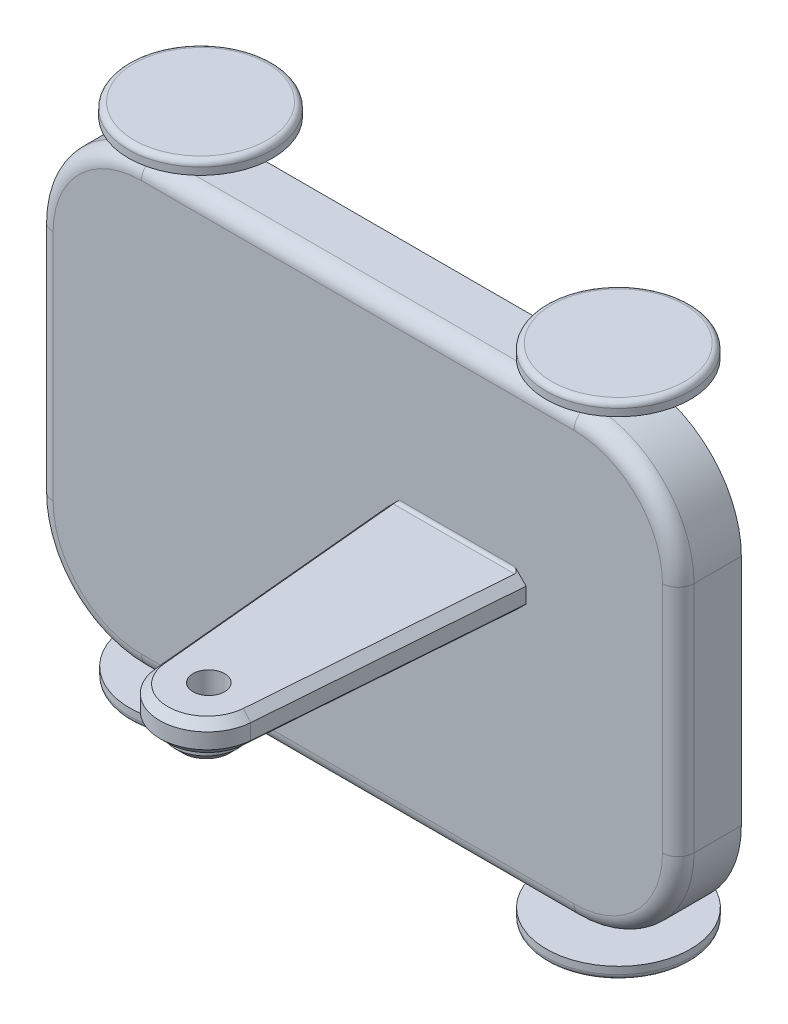
from build123d import *

# Parameters (mm, degrees)
BOSS_EXTRUDE1_DEPTH  = 20
FILLET1_R            = 5
BOSS_EXTRUDE10_DEPTH = 5
CHAMFER1_SIZE        = 2.54
CHAMFER2_SIZE        = 2.54
SKETCH13_R           = 10
BOSS_EXTRUDE11_DEPTH = 5
SKETCH14_R           = 5
CUT_EXTRUDE1_DEPTH   = 10
CHAMFER3_SIZE        = 2.54
FILLET5_R            = 1.016
BOSS_EXTRUDE13_DEPTH = 0.508
FILLET6_R            = 1.27
SKETCH16_W           = 4.572
SKETCH16_H           = 4.572
BOSS_EXTRUDE14_DEPTH = 5.588
SKETCH17_W           = 4.572
SKETCH17_H           = 4.572
BOSS_EXTRUDE15_DEPTH = 5.588
SKETCH18_W           = 4.572
SKETCH18_H           = 4.572
BOSS_EXTRUDE16_DEPTH = 5.588
SKETCH19_W           = 4.572
SKETCH19_H           = 4.572
BOSS_EXTRUDE17_DEPTH = 5.588
SKETCH20_R           = 22.86
BOSS_EXTRUDE18_DEPTH = 4.064
SKETCH21_R           = 22.86
BOSS_EXTRUDE19_DEPTH = 4.064
SKETCH22_R           = 22.86
BOSS_EXTRUDE20_DEPTH = 4.064
SKETCH23_R           = 22.86
BOSS_EXTRUDE21_DEPTH = 4.064
FILLET7_R            = 1.778


with BuildPart() as part:
    # Sketch1 → Boss-Extrude1 (new body)
    with BuildSketch(Plane.XY):
        with BuildLine():
            Line((-100.813484163, 57.805429864), (36.346515837, 57.805429864))
            ThreePointArc((36.346515837, 57.805429864), (59.695181752, 48.134095779), (69.366515837, 24.785429864))
            Line((69.366515837, 24.785429864), (69.366515837, -49.174570136))
            ThreePointArc((69.366515837, -49.174570136), (59.695181752, -72.523236051), (36.346515837, -82.194570136))
            Line((36.346515837, -82.194570136), (-100.813484163, -82.194570136))
            ThreePointArc((-100.813484163, -82.194570136), (-124.162150078, -72.523236051), (-133.833484163, -49.174570136))
            Line((-133.833484163, -49.174570136), (-133.833484163, 24.785429864))
            ThreePointArc((-133.833484163, 24.785429864), (-124.162150078, 48.134095779), (-100.813484163, 57.805429864))
        make_face()
    extrude(amount=BOSS_EXTRUDE1_DEPTH)

    # Fillet1
    fillet1_edges = [part.edges().sort_by_distance(p)[0] for p in [
        (59.695181752, -72.523236051, 20),
        (69.366515837, -12.194570136, 20),
        (59.695181752, 48.134095779, 20),
        (-32.233484163, 57.805429864, 20),
        (-124.162150078, 48.134095779, 20),
        (-133.833484163, -12.194570136, 20),
        (-124.162150078, -72.523236051, 20),
        (-32.233484163, -82.194570136, 20),
    ]]
    fillet(fillet1_edges, radius=FILLET1_R)

    # Sketch12 → Boss-Extrude10 (add, symmetric)
    with BuildSketch(Plane(origin=(0, 0, 0), x_dir=(1, 0, 0), z_dir=(0, 1, 0))):
        with BuildLine():
            Line((21.397110645, -16.554854198), (14.956705979, -101.138835481))
            ThreePointArc((14.956705979, -101.138835481), (0.134024079, -114.99940124), (-14.93396786, -101.405917476))
            Line((-14.93396786, -101.405917476), (-22.922038671, -16.554854198))
            Line((-22.922038671, -16.554854198), (21.397110645, -16.554854198))
        make_face()
    extrude(amount=BOSS_EXTRUDE10_DEPTH, both=True)

    # Chamfer1
    chamfer1_edges = [part.edges().sort_by_distance(p)[0] for p in [
        (-18.765836361, -5, 60.702958738),
        (0.134024079, -5, 114.99940124),
        (18.045747939, -5, 60.56941774),
    ]]
    chamfer(chamfer1_edges, length=CHAMFER1_SIZE)

    # Chamfer2
    chamfer2_edges = [part.edges().sort_by_distance(p)[0] for p in [
        (18.045747939, 5, 60.56941774),
        (-18.765836361, 5, 60.702958738),
        (0.134024079, 5, 114.99940124),
    ]]
    chamfer(chamfer2_edges, length=CHAMFER2_SIZE)

    # Sketch13 → Boss-Extrude11 (add)
    with BuildSketch(Plane.XZ.offset(5)):
        with Locations(Location((0.07510091, 100.368291043, 0), (0, 0, 90))):
            Circle(SKETCH13_R)
    extrude(amount=BOSS_EXTRUDE11_DEPTH)

    # Sketch14 → Cut-Extrude1 (cut)
    with BuildSketch(Plane(origin=(0, 5, 0), x_dir=(1, 0, 0), z_dir=(0, 1, 0))):
        with Locations(Location((-0.126150579, -99.354804297, 0), (0, 0, 270))):
            Circle(SKETCH14_R)
    extrude(amount=-CUT_EXTRUDE1_DEPTH, mode=Mode.SUBTRACT)

    # Chamfer3
    chamfer3_edges = [part.edges().sort_by_distance(p)[0] for p in [
        (0.07510091, -10, 90.368291043),
    ]]
    chamfer(chamfer3_edges, length=CHAMFER3_SIZE)

    # Fillet5
    fillet5_edges = [part.edges().sort_by_distance(p)[0] for p in [
        (-0.729518211, -5, 20),
        (-0.729518211, 5, 20),
    ]]
    fillet(fillet5_edges, radius=FILLET5_R)

    # Sketch15 → Boss-Extrude13 (add)
    with BuildSketch(Plane.XZ.offset(10)):
        Polygon((3.380610396, 94.811527333), (6.549019318, 100.299372565), (3.380610396, 105.787217797), (-2.956207448, 105.787217797), (-6.124616369, 100.299372565), (-2.956207448, 94.811527333), align=None)
    extrude(amount=BOSS_EXTRUDE13_DEPTH)

    # Fillet6
    # the kernel refuses this fillet: 1.27 mm, written as the material it takes off along each edge
    with BuildSketch(Plane(origin=(2.110610396, -10.508, 92.611822807), x_dir=(0, 1, 0), z_dir=(0.4999999999999995, 0, 0.866025403784439)), Plane(origin=(-5.496207448, -10.508, 94.811527333), x_dir=(0, 1, 0), z_dir=(1, 0, 0)), Plane(origin=(-7.394616369, -10.508, 102.49907709), x_dir=(0, 1, 0), z_dir=(0.4999999999999989, 0, -0.8660254037844393)), Plane(origin=(-1.686207448, -10.508, 107.986922322), x_dir=(0, 1, 0), z_dir=(-0.5000000000000007, 0, -0.8660254037844383)), Plane(origin=(5.920610396, -10.508, 105.787217797), x_dir=(0, 1, 0), z_dir=(-1, 0, 0)), Plane(origin=(7.819019318, -10.508, 98.099668039), x_dir=(0, 1, 0), z_dir=(-0.5000000000000001, 0, 0.8660254037844386))) as fillet6_piece_1:
        with BuildLine():
            CenterArc((1.27, 1.016), FILLET6_R, 180, 53.130102354)
            Line((0, 1.016), (-0.0254, 1.016))
            Line((-0.0254, 1.016), (-0.0254, 0))
            Line((-0.0254, 0), (0, -0.0254))
            ThreePointArc((0, -0.0254), (0.254, -0.0254), (0.49276, -0.02032))
            Line((0.49276, -0.02032), (0.508, 0))
        make_face()
    extrude(amount=11.416817844, mode=Mode.SUBTRACT)

    # Sketch16 → Boss-Extrude14 (add)
    with BuildSketch(Plane.XZ.offset(82.194570136)):
        with Locations((-98.470273104, 3.318730991)):
            Rectangle(SKETCH16_W, SKETCH16_H)
    extrude(amount=BOSS_EXTRUDE14_DEPTH)

    # Sketch17 → Boss-Extrude15 (add)
    with BuildSketch(Plane.XZ.offset(82.194570136)):
        with Locations((33.825615308, 3.318730991)):
            Rectangle(SKETCH17_W, SKETCH17_H)
    extrude(amount=BOSS_EXTRUDE15_DEPTH)

    # Sketch18 → Boss-Extrude16 (add)
    with BuildSketch(Plane(origin=(0, 57.805429864, 0), x_dir=(1, 0, 0), z_dir=(0, 1, 0))):
        with Locations((-98.432832856, -3.613657702)):
            Rectangle(SKETCH18_W, SKETCH18_H)
    extrude(amount=BOSS_EXTRUDE16_DEPTH)

    # Sketch19 → Boss-Extrude17 (add)
    with BuildSketch(Plane(origin=(0, 57.805429864, 0), x_dir=(1, 0, 0), z_dir=(0, 1, 0))):
        with Locations((33.90091989, -3.613657702)):
            Rectangle(SKETCH19_W, SKETCH19_H)
    extrude(amount=BOSS_EXTRUDE17_DEPTH)

    # Sketch20 → Boss-Extrude18 (add)
    with BuildSketch(Plane.XZ.offset(87.782570136)):
        with Locations(Location((-98.565816777, 3.198071139, 0), (0, 0, 270))):
            Circle(SKETCH20_R)
    extrude(amount=BOSS_EXTRUDE18_DEPTH)

    # Sketch21 → Boss-Extrude19 (add)
    with BuildSketch(Plane.XZ.offset(87.782570136)):
        with Locations(Location((33.758975708, 3.354248453, 0), (0, 0, 270))):
            Circle(SKETCH21_R)
    extrude(amount=BOSS_EXTRUDE19_DEPTH)

    # Sketch22 → Boss-Extrude20 (add)
    with BuildSketch(Plane(origin=(0, 63.393429864, 0), x_dir=(1, 0, 0), z_dir=(0, 1, 0))):
        with Locations(Location((33.999309206, -3.675015511, 0), (0, 0, 270))):
            Circle(SKETCH22_R)
    extrude(amount=BOSS_EXTRUDE20_DEPTH)

    # Sketch23 → Boss-Extrude21 (add)
    with BuildSketch(Plane(origin=(0, 63.393429864, 0), x_dir=(1, 0, 0), z_dir=(0, 1, 0))):
        with Locations(Location((-98.490534762, -3.604957743, 0), (0, 0, 270))):
            Circle(SKETCH23_R)
    extrude(amount=BOSS_EXTRUDE21_DEPTH)

    # Fillet7
    fillet7_edges = [part.edges().sort_by_distance(p)[0] for p in [
        (-98.565816777, -91.846570136, 26.058071139),
        (33.758975708, -91.846570136, 26.214248453),
        (33.999309206, 67.457429864, -19.184984489),
        (-98.490534762, 67.457429864, -19.255042257),
    ]]
    fillet(fillet7_edges, radius=FILLET7_R)


solid = part.part
